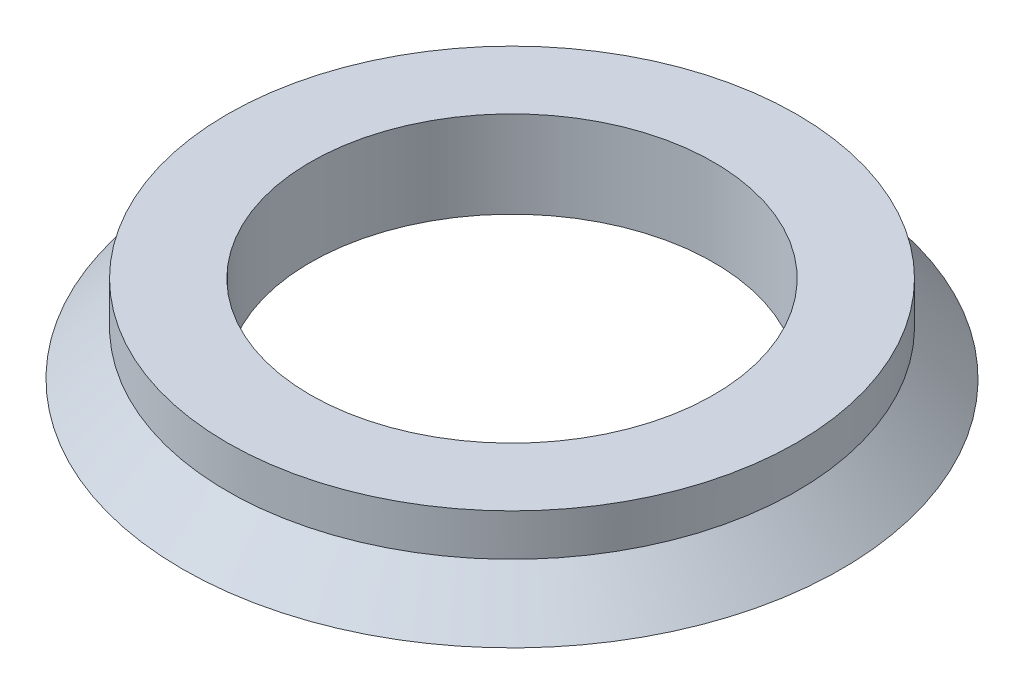
from build123d import *

# Parameters (mm, degrees)
SKETCH1_R           = 11
SKETCH1_R_2         = 6.731
BOSS_EXTRUDE1_DEPTH = 1.5
CHAMFER1_SIZE       = 1.5
SKETCH2_R           = 9.5
SKETCH2_R_2         = 6.731
BOSS_EXTRUDE2_DEPTH = 1.4


with BuildPart() as part:
    # Sketch1 → Boss-Extrude1 (new body)
    with BuildSketch(Plane(origin=(0, 0, 0), x_dir=(1, 0, 0), z_dir=(0, 1, 0))):
        with Locations(Location((0, 0, 0), (0, 0, 270))):
            Circle(SKETCH1_R)
        with Locations(Location((0, 0, 0), (0, 0, 270))):
            Circle(SKETCH1_R_2, mode=Mode.SUBTRACT)
    extrude(amount=BOSS_EXTRUDE1_DEPTH)

    # Chamfer1
    chamfer1_edges = [part.edges().sort_by_distance(p)[0] for p in [
        (0, 1.5, -11),
    ]]
    chamfer(chamfer1_edges, length=CHAMFER1_SIZE - 0.0001)  # a hair under: the kernel refuses the full size

    # Sketch2 → Boss-Extrude2 (add)
    with BuildSketch(Plane(origin=(0, 1.5, 0), x_dir=(1, 0, 0), z_dir=(0, 1, 0))):
        with Locations(Location((0, 0, 0), (0, 0, 90))):
            Circle(SKETCH2_R)
        with Locations(Location((0, 0, 0), (0, 0, 270))):
            Circle(SKETCH2_R_2, mode=Mode.SUBTRACT)
    extrude(amount=BOSS_EXTRUDE2_DEPTH)


solid = part.part
